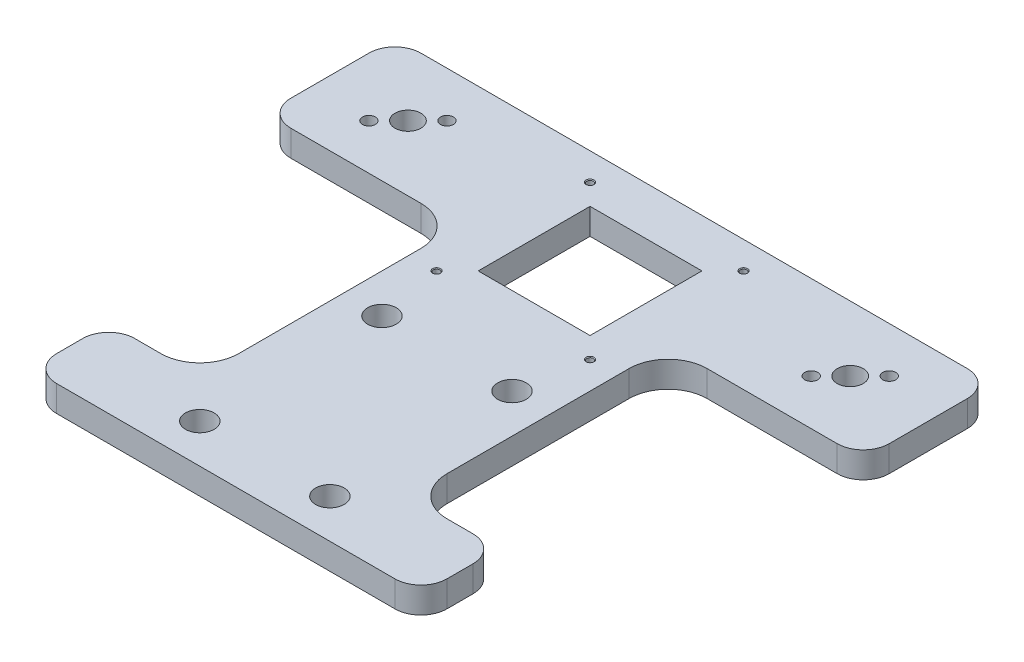
from build123d import *

# Parameters (mm, degrees)
AUFSATZ_LINEAR_AUSTRAGEN1_DEPTH  = 10
F_10_0_10_DURCHMESSER_BOHRUNG1_D = 10
SKIZZE8_W                        = 43
SKIZZE8_H                        = 43
SCHNITT_LINEAR_AUSTRAGEN2_DEPTH  = 10
M3_GEWINDEBOHRUNG1_D             = 2.5
M3_GEWINDEBOHRUNG1_DEPTH         = 8
M3_GEWINDEBOHRUNG1_CSINK_D       = 3.05
M3_GEWINDEBOHRUNG1_CSINK_ANGLE   = 90
M3_GEWINDEBOHRUNG1_TIP           = 0.751075774
F_5_0_5_DURCHMESSER_BOHRUNG1_D   = 5
DURCHGANGSLOCH_F_R_M101_D        = 11


with BuildPart() as part:
    # Skizze1 → Aufsatz-Linear austragen1 (new body)
    with BuildSketch(Plane(origin=(0, 0, 0), x_dir=(1, 0, 0), z_dir=(0, 1, 0))):
        with BuildLine():
            Line((-105, 90), (105, 90))
            ThreePointArc((105, 90), (112.071067812, 87.071067812), (115, 80))
            Line((115, 80), (115, 50))
            ThreePointArc((115, 50), (112.071067812, 42.928932188), (105, 40))
            Line((105, 40), (55, 40))
            ThreePointArc((55, 40), (44.393398282, 35.606601718), (40, 25))
            Line((40, 25), (40, -45))
            ThreePointArc((40, -45), (44.393398282, -55.606601718), (55, -60))
            Line((55, -60), (65, -60))
            ThreePointArc((65, -60), (72.071067812, -62.928932188), (75, -70))
            Line((75, -70), (75, -80))
            ThreePointArc((75, -80), (72.071067812, -87.071067812), (65, -90))
            Line((65, -90), (-65, -90))
            ThreePointArc((-65, -90), (-72.071067812, -87.071067812), (-75, -80))
            Line((-75, -80), (-75, -70))
            ThreePointArc((-75, -70), (-72.071067812, -62.928932188), (-65, -60))
            Line((-65, -60), (-55, -60))
            ThreePointArc((-55, -60), (-44.393398282, -55.606601718), (-40, -45))
            Line((-40, -45), (-40, 25))
            ThreePointArc((-40, 25), (-44.393398282, 35.606601718), (-55, 40))
            Line((-55, 40), (-105, 40))
            ThreePointArc((-105, 40), (-112.071067812, 42.928932188), (-115, 50))
            Line((-115, 50), (-115, 80))
            ThreePointArc((-115, 80), (-112.071067812, 87.071067812), (-105, 90))
        make_face()
    extrude(amount=AUFSATZ_LINEAR_AUSTRAGEN1_DEPTH)

    # Ø10.0 (10) Durchmesser Bohrung1 (through all)
    with Locations(Plane(origin=(0, 10, 0), x_dir=(1, 0, 0), z_dir=(0, 1, 0))):
        with Locations((-85, 65), (85, 65)):
            Hole(F_10_0_10_DURCHMESSER_BOHRUNG1_D / 2)

    # Skizze8 → Schnitt-Linear austragen2 (cut)
    with BuildSketch(Plane(origin=(0, 10, 0), x_dir=(1, 0, 0), z_dir=(0, 1, 0))):
        with Locations((0, 50)):
            Rectangle(SKIZZE8_W, SKIZZE8_H)
    extrude(amount=-SCHNITT_LINEAR_AUSTRAGEN2_DEPTH, mode=Mode.SUBTRACT)

    # M3 Gewindebohrung1
    with Locations(Plane(origin=(0, 10, 0), x_dir=(1, 0, 0), z_dir=(0, 1, 0))):
        with Locations((-29.5, 79.5), (-29.5, 20.5), (29.5, 20.5), (29.5, 79.5)):
            CounterSinkHole(M3_GEWINDEBOHRUNG1_D / 2, M3_GEWINDEBOHRUNG1_CSINK_D / 2, depth=M3_GEWINDEBOHRUNG1_DEPTH, counter_sink_angle=M3_GEWINDEBOHRUNG1_CSINK_ANGLE)
            with Locations((0, 0, -(M3_GEWINDEBOHRUNG1_DEPTH + M3_GEWINDEBOHRUNG1_TIP / 2))):  # 118° drill point
                Cone(0, M3_GEWINDEBOHRUNG1_D / 2, M3_GEWINDEBOHRUNG1_TIP, mode=Mode.SUBTRACT)

    # Ø5.0 (5) Durchmesser Bohrung1 (through all)
    with Locations(Plane(origin=(0, 0, 0), x_dir=(-1, 0, 0), z_dir=(0, -1, 0))):
        with Locations((77.5, 72.5), (92.5, 57.5), (-92.5, 72.5), (-77.5, 57.5)):
            Hole(F_5_0_5_DURCHMESSER_BOHRUNG1_D / 2)

    # Durchgangsloch für M101 (through all)
    with Locations(Plane(origin=(0, 0, 0), x_dir=(-1, 0, 0), z_dir=(0, -1, 0))):
        with Locations((-25, -5), (-25, -75), (25, -5), (25, -75)):
            Hole(DURCHGANGSLOCH_F_R_M101_D / 2)


solid = part.part
